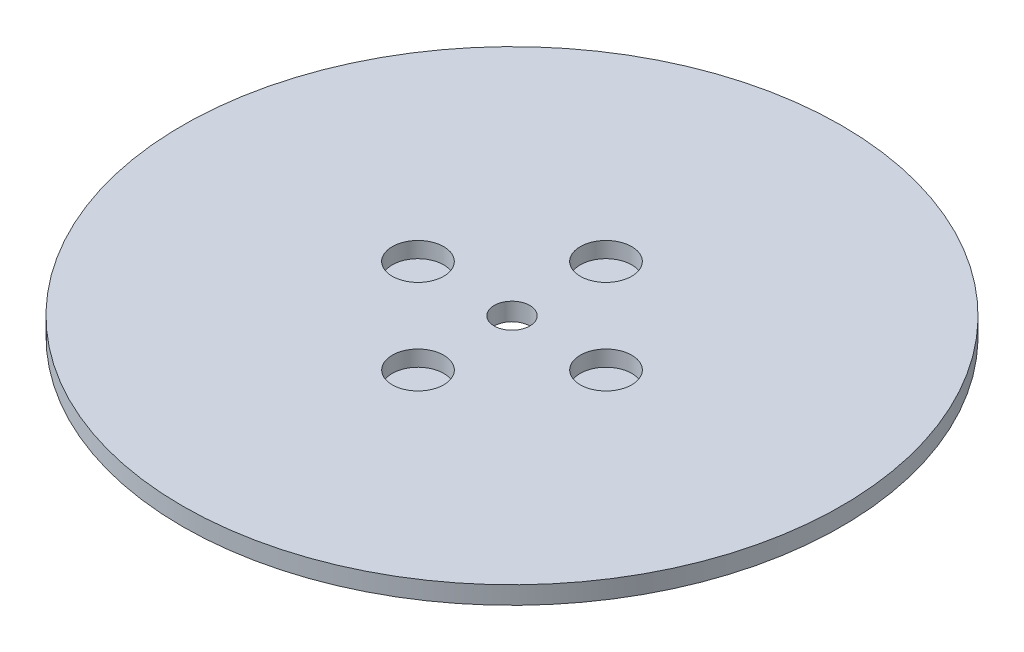
from build123d import *

# Parameters (mm, degrees)
SKETCH1_R           = 92.5
BOSS_EXTRUDE1_DEPTH = 5
SKETCH2_R           = 5
CUT_EXTRUDE1_DEPTH  = 131.910274616
SKETCH3_R           = 7.218891406
CUT_EXTRUDE2_DEPTH  = 4.435535613
CIRPATTERN1_COUNT   = 4


with BuildPart() as part:
    # Sketch1 → Boss-Extrude1 (new body)
    with BuildSketch(Plane(origin=(0, 0, 0), x_dir=(1, 0, 0), z_dir=(0, 1, 0))):
        Circle(SKETCH1_R)
    extrude(amount=BOSS_EXTRUDE1_DEPTH)

    # Sketch2 → Cut-Extrude1 (cut, through all)
    with BuildSketch(Plane(origin=(0, 0, 0), x_dir=(1, 0, 0), z_dir=(0, 1, 0))):
        Circle(SKETCH2_R)
    extrude(amount=CUT_EXTRUDE1_DEPTH, mode=Mode.SUBTRACT)

    # Sketch3 → Cut-Extrude2 (cut)
    with BuildSketch(Plane(origin=(0, 5, 0), x_dir=(1, 0, 0), z_dir=(0, 1, 0))):
        with Locations((-26.385390829, 0)):
            Circle(SKETCH3_R)
    cut_extrude2 = extrude(amount=-CUT_EXTRUDE2_DEPTH, mode=Mode.SUBTRACT)

    # CirPattern1: Cut-Extrude2 ×4 about axis
    cirpattern1_axis = Axis((0, 0, 0), (0, 1, 0))
    for i in range(1, CIRPATTERN1_COUNT):
        add(cut_extrude2.rotate(cirpattern1_axis, i * 360 / CIRPATTERN1_COUNT), mode=Mode.SUBTRACT)


solid = part.part
